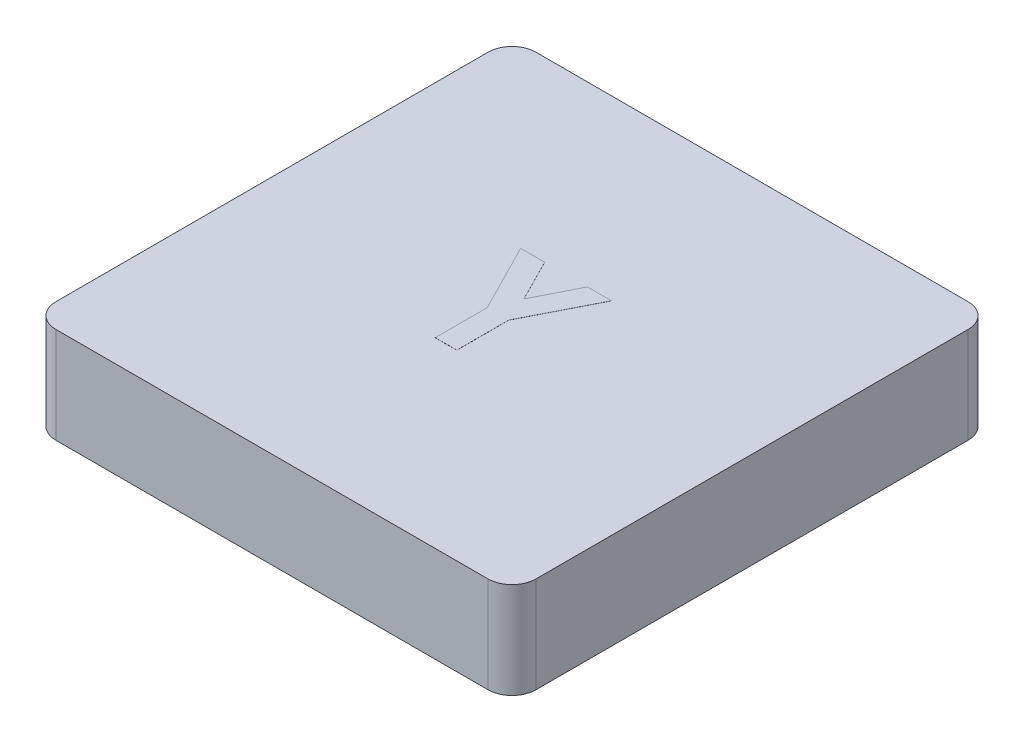
from build123d import *

# Parameters (mm, degrees)
SKETCH1_W           = 12.7
SKETCH1_H           = 12.7
BOSS_EXTRUDE1_DEPTH = 2.54
FILLET1_R           = 0.635
SHELL1_START        = 0.635
SHELL1_OUTLINE_W    = 1.905
SHELL1_OUTLINE_H    = 11.43
SHELL1_DEPTH        = 11.43
SKETCH2_R           = 2.54
BOSS_EXTRUDE2_DEPTH = 1.905
BOSS_EXTRUDE3_DEPTH = 0.00254


# Read off the part's stored shape, not the designer's step: Shell1
with BuildPart() as part:
    # Sketch1 → Boss-Extrude1 (new body)
    with BuildSketch(Plane(origin=(0, 0, 0), x_dir=(1, 0, 0), z_dir=(0, 1, 0))):
        with Locations((6.35, 6.35)):
            Rectangle(SKETCH1_W, SKETCH1_H)
    extrude(amount=BOSS_EXTRUDE1_DEPTH)

    # Fillet1
    fillet1_edges = [part.edges().sort_by_distance(p)[0] for p in [
        (0, 1.27, -12.7),
        (12.7, 1.27, -12.7),
        (12.7, 1.27, 0),
        (0, 1.27, 0),
    ]]
    fillet(fillet1_edges, radius=FILLET1_R)

    # Shell1 outline → Shell1 (cut)
    with BuildSketch(Plane.YZ.offset(SHELL1_START)):
        with Locations((0.9525, -6.35)):
            Rectangle(SHELL1_OUTLINE_W, SHELL1_OUTLINE_H)
    extrude(amount=SHELL1_DEPTH, mode=Mode.SUBTRACT)

    # Sketch2 → Boss-Extrude2 (add)
    with BuildSketch(Plane(origin=(0, 1.905, 0), x_dir=(-1, 0, 0), z_dir=(0, -1, 0))):
        with Locations(Location((-6.35, 6.35, 0), (0, 0, 270))):
            Circle(SKETCH2_R)
    extrude(amount=BOSS_EXTRUDE2_DEPTH)

    # Sketch3 → Boss-Extrude3 (add)
    with BuildSketch(Plane(origin=(0, 2.54, 0), x_dir=(1, 0, 0), z_dir=(0, 1, 0))):
        Polygon((4.927762821, 8.001), (5.561872396, 8.001), (6.128564103, 6.887333133), (6.695255809, 8.001), (7.329365385, 8.001), (6.4135, 6.201070112), (6.4135, 4.826), (5.843628205, 4.826), (5.843628205, 6.201070112), align=None)
    extrude(amount=BOSS_EXTRUDE3_DEPTH)


solid = part.part
